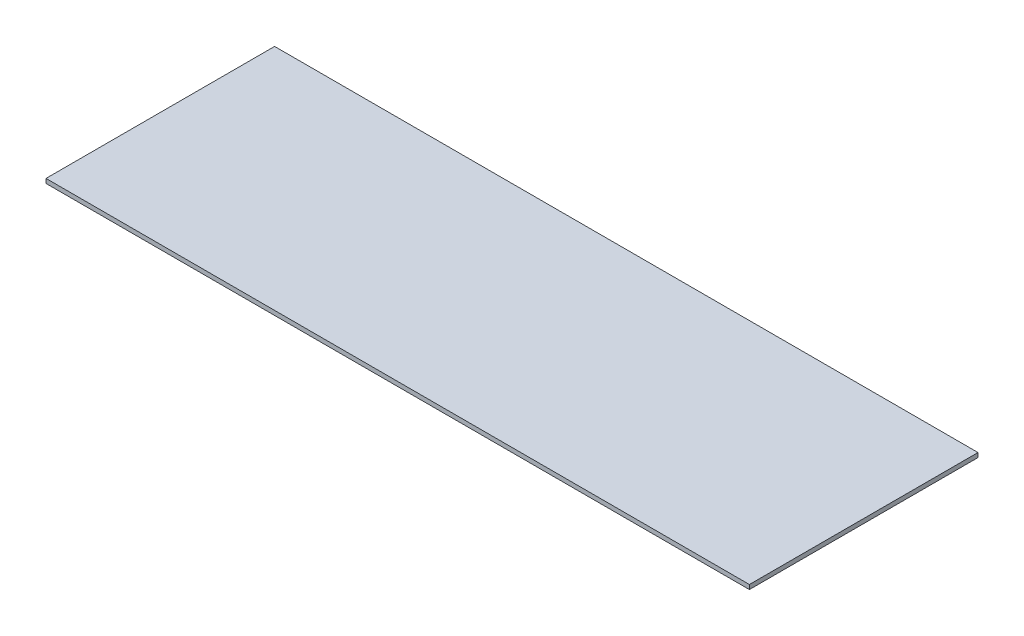
from build123d import *

# Parameters (mm, degrees)
SKETCH1_W           = 508
SKETCH1_H           = 165.1
BOSS_EXTRUDE1_DEPTH = 3.175


with BuildPart() as part:
    # Sketch1 → Boss-Extrude1 (new body)
    with BuildSketch(Plane(origin=(0, 0, 0), x_dir=(1, 0, 0), z_dir=(0, 1, 0))):
        with Locations((254, -82.55)):
            Rectangle(SKETCH1_W, SKETCH1_H)
    extrude(amount=BOSS_EXTRUDE1_DEPTH)


solid = part.part
